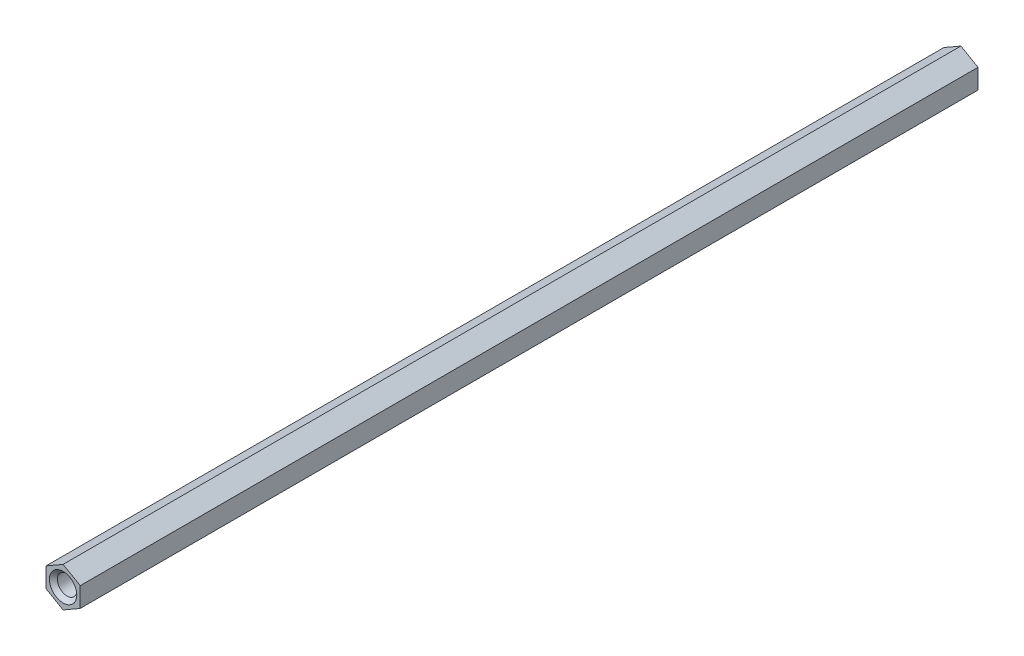
from build123d import *

# Parameters (mm, degrees)
BOSS_EXTRUDE1_DEPTH               = 125
F_1_4_28_TAPPED_HOLE1_D           = 5.4102
F_1_4_28_TAPPED_HOLE1_DEPTH       = 15.24
F_1_4_28_TAPPED_HOLE1_CSINK_D     = 7.62
F_1_4_28_TAPPED_HOLE1_CSINK_ANGLE = 90
F_1_4_28_TAPPED_HOLE1_TIP         = 1.625388061
F_1_4_28_TAPPED_HOLE2_D           = 5.4102
F_1_4_28_TAPPED_HOLE2_DEPTH       = 17.2339
F_1_4_28_TAPPED_HOLE2_CSINK_D     = 7.62
F_1_4_28_TAPPED_HOLE2_CSINK_ANGLE = 90
F_1_4_28_TAPPED_HOLE2_TIP         = 1.625388061


with BuildPart() as part:
    # Sketch3 → Boss-Extrude1 (new, symmetric)
    with BuildSketch(Plane.XY):
        Polygon((0, 5.499261314), (4.7625, 2.749630657), (4.7625, -2.749630657), (0, -5.499261314), (-4.7625, -2.749630657), (-4.7625, 2.749630657), align=None)
    extrude(amount=BOSS_EXTRUDE1_DEPTH, both=True)

    # 1/4-28 Tapped Hole1
    with Locations(Plane.XY.offset(125)):
        with Locations((0, 0)):
            CounterSinkHole(F_1_4_28_TAPPED_HOLE1_D / 2, F_1_4_28_TAPPED_HOLE1_CSINK_D / 2, depth=F_1_4_28_TAPPED_HOLE1_DEPTH, counter_sink_angle=F_1_4_28_TAPPED_HOLE1_CSINK_ANGLE)
            with Locations((0, 0, -(F_1_4_28_TAPPED_HOLE1_DEPTH + F_1_4_28_TAPPED_HOLE1_TIP / 2))):  # 118° drill point
                Cone(0, F_1_4_28_TAPPED_HOLE1_D / 2, F_1_4_28_TAPPED_HOLE1_TIP, mode=Mode.SUBTRACT)

    # 1/4-28 Tapped Hole2
    with Locations(Plane(origin=(0, 0, -125), x_dir=(-1, 0, 0), z_dir=(0, 0, -1))):
        with Locations((0, 0)):
            CounterSinkHole(F_1_4_28_TAPPED_HOLE2_D / 2, F_1_4_28_TAPPED_HOLE2_CSINK_D / 2, depth=F_1_4_28_TAPPED_HOLE2_DEPTH, counter_sink_angle=F_1_4_28_TAPPED_HOLE2_CSINK_ANGLE)
            with Locations((0, 0, -(F_1_4_28_TAPPED_HOLE2_DEPTH + F_1_4_28_TAPPED_HOLE2_TIP / 2))):  # 118° drill point
                Cone(0, F_1_4_28_TAPPED_HOLE2_D / 2, F_1_4_28_TAPPED_HOLE2_TIP, mode=Mode.SUBTRACT)


solid = part.part
